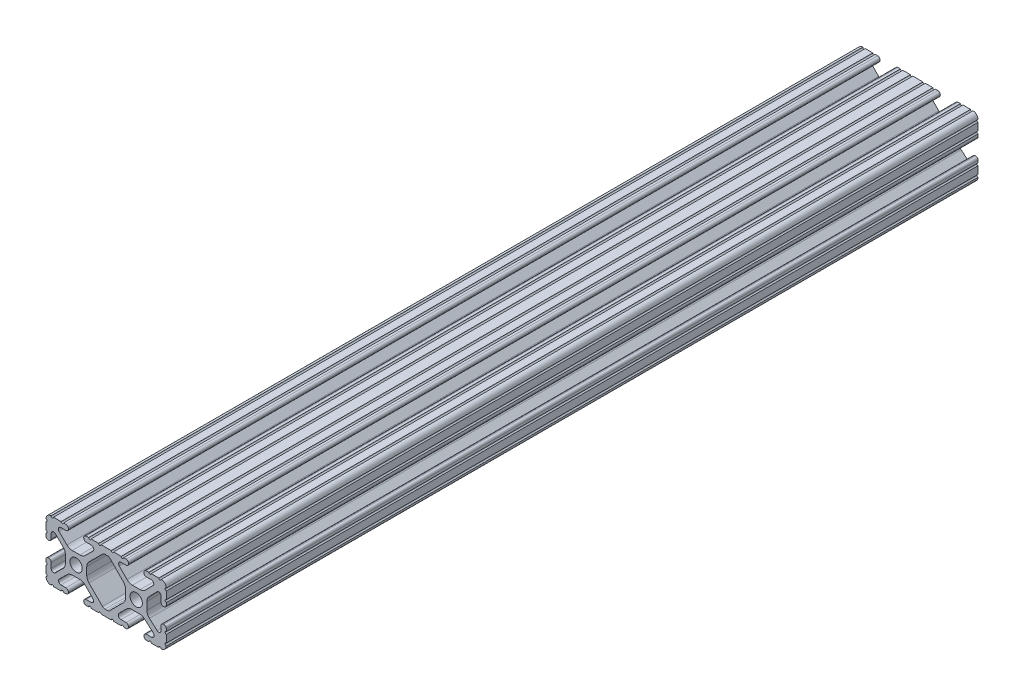
from build123d import *

# Parameters (mm, degrees)
SKETCH1_R           = 2.6035
BOSS_EXTRUDE1_DEPTH = 171.45


with BuildPart() as part:
    # Sketch1 → Boss-Extrude1 (new, symmetric)
    with BuildSketch(Plane.XY):
        with BuildLine():
            Line((18.01710265, 12.7), (16.98745015, 12.7))
            ThreePointArc((16.98745015, 12.7), (16.245730386, 12.392769614), (15.9385, 11.65104985))
            Line((15.9385, 11.65104985), (15.9385, 11.53922))
            ThreePointArc((15.9385, 11.53922), (16.245750844, 10.797450844), (16.98752, 10.4902))
            Line((16.98752, 10.4902), (19.116384363, 10.4902))
            ThreePointArc((19.116384363, 10.4902), (20.052502933, 9.869096983), (19.844087081, 8.765172272))
            Line((19.844087081, 8.765172272), (16.618993479, 5.455112286))
            ThreePointArc((16.618993479, 5.455112286), (15.578994274, 4.745442459), (14.344932584, 4.4958))
            Line((14.344932584, 4.4958), (11.083317835, 4.4958))
            ThreePointArc((11.083317835, 4.4958), (9.854330953, 4.743306833), (8.816955189, 5.447238587))
            Line((8.816955189, 5.447238587), (5.564154119, 8.762652677))
            ThreePointArc((5.564154119, 8.762652677), (5.352591412, 9.867473037), (6.289393385, 10.4902))
            Line((6.289393385, 10.4902), (8.41248, 10.4902))
            ThreePointArc((8.41248, 10.4902), (9.154249156, 10.797450844), (9.4615, 11.53922))
            Line((9.4615, 11.53922), (9.4615, 11.65104985))
            ThreePointArc((9.4615, 11.65104985), (9.154269614, 12.392769614), (8.41254985, 12.7))
            Line((8.41254985, 12.7), (7.38288465, 12.7))
            ThreePointArc((7.38288465, 12.7), (6.87488465, 12.192), (6.36688465, 12.7))
            Line((6.36688465, 12.7), (3.14958095, 12.7))
            ThreePointArc((3.14958095, 12.7), (2.64158095, 12.192), (2.13358095, 12.7))
            Line((2.13358095, 12.7), (-2.13358095, 12.7))
            ThreePointArc((-2.13358095, 12.7), (-2.64158095, 12.192), (-3.14958095, 12.7))
            Line((-3.14958095, 12.7), (-6.36689735, 12.7))
            ThreePointArc((-6.36689735, 12.7), (-6.87489735, 12.192), (-7.38289735, 12.7))
            Line((-7.38289735, 12.7), (-8.41254985, 12.7))
            ThreePointArc((-8.41254985, 12.7), (-9.154269614, 12.392769614), (-9.4615, 11.65104985))
            Line((-9.4615, 11.65104985), (-9.4615, 11.53922))
            ThreePointArc((-9.4615, 11.53922), (-9.154249156, 10.797450844), (-8.41248, 10.4902))
            Line((-8.41248, 10.4902), (-6.283641037, 10.4902))
            ThreePointArc((-6.283641037, 10.4902), (-5.297291557, 9.829633109), (-5.532576693, 8.666071843))
            Line((-5.532576693, 8.666071843), (-8.809985098, 5.416263103))
            ThreePointArc((-8.809985098, 5.416263103), (-9.836720513, 4.734920264), (-11.045536121, 4.4958))
            Line((-11.045536121, 4.4958), (-14.354463879, 4.4958))
            ThreePointArc((-14.354463879, 4.4958), (-15.563279487, 4.734920264), (-16.590014902, 5.416263103))
            Line((-16.590014902, 5.416263103), (-19.867423307, 8.666071843))
            ThreePointArc((-19.867423307, 8.666071843), (-20.102708443, 9.829633109), (-19.116358963, 10.4902))
            Line((-19.116358963, 10.4902), (-16.98752, 10.4902))
            ThreePointArc((-16.98752, 10.4902), (-16.245750844, 10.797450844), (-15.9385, 11.53922))
            Line((-15.9385, 11.53922), (-15.9385, 11.65104985))
            ThreePointArc((-15.9385, 11.65104985), (-16.245730386, 12.392769614), (-16.98745015, 12.7))
            Line((-16.98745015, 12.7), (-18.01711535, 12.7))
            ThreePointArc((-18.01711535, 12.7), (-18.52511535, 12.192), (-19.03311535, 12.7))
            Line((-19.03311535, 12.7), (-22.2504, 12.7))
            ThreePointArc((-22.2504, 12.7), (-22.758323491, 12.192000006), (-23.266399977, 12.699846982))
            ThreePointArc((-23.266399977, 12.699846982), (-24.782522516, 12.082522516), (-25.399846982, 10.566399977))
            ThreePointArc((-25.399846982, 10.566399977), (-24.892000006, 10.058323491), (-25.4, 9.5504))
            Line((-25.4, 9.5504), (-25.4, 6.3330836))
            ThreePointArc((-25.4, 6.3330836), (-24.892, 5.8250836), (-25.4, 5.3170836))
            Line((-25.4, 5.3170836), (-25.4, 4.237520184))
            ThreePointArc((-25.4, 4.237520184), (-25.107393763, 3.531106237), (-24.400979816, 3.2385))
            Line((-24.400979816, 3.2385), (-24.23922, 3.2385))
            ThreePointArc((-24.23922, 3.2385), (-23.497450844, 3.545750844), (-23.1902, 4.28752))
            Line((-23.1902, 4.28752), (-23.1902, 6.334741132))
            ThreePointArc((-23.1902, 6.334741132), (-22.556026952, 7.286023527), (-21.434002553, 7.066535717))
            Line((-21.434002553, 7.066535717), (-18.147950853, 3.808156468))
            ThreePointArc((-18.147950853, 3.808156468), (-17.452759693, 2.774838327), (-17.208501877, 1.553619571))
            Line((-17.208501877, 1.553619571), (-17.208501877, -1.695179196))
            ThreePointArc((-17.208501877, -1.695179196), (-17.450738657, -2.911536421), (-18.140486065, -3.942289578))
            Line((-18.140486065, -3.942289578), (-21.431579576, -7.227386226))
            ThreePointArc((-21.431579576, -7.227386226), (-22.55444896, -7.449940594), (-23.1902, -6.498002195))
            Line((-23.1902, -6.498002195), (-23.1902, -4.28752))
            ThreePointArc((-23.1902, -4.28752), (-23.497450844, -3.545750844), (-24.23922, -3.2385))
            Line((-24.23922, -3.2385), (-24.35098, -3.2385))
            ThreePointArc((-24.35098, -3.2385), (-25.092749156, -3.545750844), (-25.4, -4.28752))
            Line((-25.4, -4.28752), (-25.4, -5.3171344))
            ThreePointArc((-25.4, -5.3171344), (-24.892, -5.8251344), (-25.4, -6.3331344))
            Line((-25.4, -6.3331344), (-25.4, -9.5504))
            ThreePointArc((-25.4, -9.5504), (-24.892000006, -10.058323491), (-25.399846982, -10.566399977))
            ThreePointArc((-25.399846982, -10.566399977), (-24.782522516, -12.082522516), (-23.266399977, -12.699846982))
            ThreePointArc((-23.266399977, -12.699846982), (-22.758323491, -12.192000006), (-22.2504, -12.7))
            Line((-22.2504, -12.7), (-19.03308995, -12.7))
            ThreePointArc((-19.03308995, -12.7), (-18.52508995, -12.192), (-18.01708995, -12.7))
            Line((-18.01708995, -12.7), (-16.9874692, -12.7))
            ThreePointArc((-16.9874692, -12.7), (-16.245700044, -12.392749156), (-15.9384492, -11.65098))
            Line((-15.9384492, -11.65098), (-15.9384492, -11.53922))
            ThreePointArc((-15.9384492, -11.53922), (-16.245700044, -10.797450844), (-16.9874692, -10.4902))
            Line((-16.9874692, -10.4902), (-19.116358963, -10.4902))
            ThreePointArc((-19.116358963, -10.4902), (-20.055197748, -9.862578342), (-19.834124023, -8.755124678))
            Line((-19.834124023, -8.755124678), (-16.49660751, -5.423689618))
            ThreePointArc((-16.49660751, -5.423689618), (-15.467274017, -4.736928798), (-14.253591699, -4.4958))
            Line((-14.253591699, -4.4958), (-11.146408301, -4.4958))
            ThreePointArc((-11.146408301, -4.4958), (-9.932725983, -4.736928798), (-8.90339249, -5.423689618))
            Line((-8.90339249, -5.423689618), (-5.565875977, -8.755124678))
            ThreePointArc((-5.565875977, -8.755124678), (-5.344802252, -9.862578342), (-6.283641037, -10.4902))
            Line((-6.283641037, -10.4902), (-8.4125308, -10.4902))
            ThreePointArc((-8.4125308, -10.4902), (-9.154299956, -10.797450844), (-9.4615508, -11.53922))
            Line((-9.4615508, -11.53922), (-9.4615508, -11.65098))
            ThreePointArc((-9.4615508, -11.65098), (-9.154299956, -12.392749156), (-8.4125308, -12.7))
            Line((-8.4125308, -12.7), (-7.38287195, -12.7))
            ThreePointArc((-7.38287195, -12.7), (-6.87487195, -12.192), (-6.36687195, -12.7))
            Line((-6.36687195, -12.7), (-3.14960635, -12.7))
            ThreePointArc((-3.14960635, -12.7), (-2.64160635, -12.192), (-2.13360635, -12.7))
            Line((-2.13360635, -12.7), (2.13360635, -12.7))
            ThreePointArc((2.13360635, -12.7), (2.64159365, -12.1920127), (3.14958095, -12.7))
            Line((3.14958095, -12.7), (6.36691005, -12.7))
            ThreePointArc((6.36691005, -12.7), (6.87491005, -12.192), (7.38291005, -12.7))
            Line((7.38291005, -12.7), (8.4125308, -12.7))
            ThreePointArc((8.4125308, -12.7), (9.154299956, -12.392749156), (9.4615508, -11.65098))
            Line((9.4615508, -11.65098), (9.4615508, -11.53922))
            ThreePointArc((9.4615508, -11.53922), (9.154299956, -10.797450844), (8.4125308, -10.4902))
            Line((8.4125308, -10.4902), (6.289393385, -10.4902))
            ThreePointArc((6.289393385, -10.4902), (5.231590322, -9.783049717), (5.480677245, -8.535265862))
            Line((5.480677245, -8.535265862), (8.597933595, -5.423689618))
            ThreePointArc((8.597933595, -5.423689618), (9.627267088, -4.736928798), (10.840949406, -4.4958))
            Line((10.840949406, -4.4958), (14.102564155, -4.4958))
            ThreePointArc((14.102564155, -4.4958), (15.215927525, -4.697410182), (16.187895372, -5.276636531))
            Line((16.187895372, -5.276636531), (19.868247549, -8.482246082))
            ThreePointArc((19.868247549, -8.482246082), (20.188435806, -9.746879864), (19.116384363, -10.4902))
            Line((19.116384363, -10.4902), (16.9874692, -10.4902))
            ThreePointArc((16.9874692, -10.4902), (16.245700044, -10.797450844), (15.9384492, -11.53922))
            Line((15.9384492, -11.53922), (15.9384492, -11.65098))
            ThreePointArc((15.9384492, -11.65098), (16.245700044, -12.392749156), (16.9874692, -12.7))
            Line((16.9874692, -12.7), (18.01710265, -12.7))
            ThreePointArc((18.01710265, -12.7), (18.52510265, -12.192), (19.03310265, -12.7))
            Line((19.03310265, -12.7), (22.2504, -12.7))
            ThreePointArc((22.2504, -12.7), (22.758323491, -12.192000006), (23.266399977, -12.699846982))
            ThreePointArc((23.266399977, -12.699846982), (24.782522516, -12.082522516), (25.399846982, -10.566399977))
            ThreePointArc((25.399846982, -10.566399977), (24.892000006, -10.058323492), (25.4, -9.550400001))
            Line((25.4, -9.550400001), (25.4, -6.333083592))
            ThreePointArc((25.4, -6.333083592), (24.892000001, -5.825083593), (25.4, -5.317083593))
            Line((25.4, -5.317083593), (25.4, -4.237520184))
            ThreePointArc((25.4, -4.237520184), (25.107393763, -3.531106237), (24.400979816, -3.2385))
            Line((24.400979816, -3.2385), (24.189220184, -3.2385))
            ThreePointArc((24.189220184, -3.2385), (23.482806237, -3.531106237), (23.1902, -4.237520184))
            Line((23.1902, -4.237520184), (23.1902, -6.155876159))
            ThreePointArc((23.1902, -6.155876159), (22.62232736, -7.038258539), (21.583974541, -6.886926384))
            Line((21.583974541, -6.886926384), (18.29817066, -4.024970844))
            ThreePointArc((18.29817066, -4.024970844), (17.493730985, -2.946044689), (17.208501877, -1.630807374))
            Line((17.208501877, -1.630807374), (17.208501877, 1.630807374))
            ThreePointArc((17.208501877, 1.630807374), (17.442348332, 2.82673414), (18.109440981, 3.846495088))
            Line((18.109440981, 3.846495088), (21.526346532, 7.353420386))
            ThreePointArc((21.526346532, 7.353420386), (22.585896263, 7.574939077), (23.1902, 6.676867167))
            Line((23.1902, 6.676867167), (23.1902, 4.237520184))
            ThreePointArc((23.1902, 4.237520184), (23.482806237, 3.531106237), (24.189220184, 3.2385))
            Line((24.189220184, 3.2385), (24.400979816, 3.2385))
            ThreePointArc((24.400979816, 3.2385), (25.107393763, 3.531106237), (25.4, 4.237520184))
            Line((25.4, 4.237520184), (25.4, 5.3170836))
            ThreePointArc((25.4, 5.3170836), (24.891949193, 5.825134407), (25.4, 6.333185215))
            Line((25.4, 6.333185215), (25.4, 9.550400015))
            ThreePointArc((25.4, 9.550400015), (24.892000013, 10.058323498), (25.399846982, 10.566399977))
            ThreePointArc((25.399846982, 10.566399977), (24.782522516, 12.082522516), (23.266399977, 12.699846982))
            ThreePointArc((23.266399977, 12.699846982), (22.758323491, 12.192000006), (22.2504, 12.7))
            Line((22.2504, 12.7), (19.03310265, 12.7))
            ThreePointArc((19.03310265, 12.7), (18.52510265, 12.192), (18.01710265, 12.7))
        make_face()
        with Locations((-12.7, 0)):
            Circle(SKETCH1_R, mode=Mode.SUBTRACT)
        with Locations((12.7, 0)):
            Circle(SKETCH1_R, mode=Mode.SUBTRACT)
        with BuildLine():
            Line((-7.259513935, -3.869413038), (-1.545748891, -9.572766749))
            ThreePointArc((-1.545748891, -9.572766749), (-1.035199478, -9.913400116), (-0.433213048, -10.033))
            Line((-0.433213048, -10.033), (0.433213048, -10.033))
            ThreePointArc((0.433213048, -10.033), (1.035199478, -9.913400116), (1.545748891, -9.572766749))
            Line((1.545748891, -9.572766749), (7.259513935, -3.869413038))
            ThreePointArc((7.259513935, -3.869413038), (7.949261343, -2.838659881), (8.191498123, -1.622302656))
            Line((8.191498123, -1.622302656), (8.191498123, 1.622302656))
            ThreePointArc((8.191498123, 1.622302656), (7.955573352, 2.823327967), (7.282860769, 3.845864069))
            Line((7.282860769, 3.845864069), (1.675572808, 9.561086461))
            ThreePointArc((1.675572808, 9.561086461), (1.161034429, 9.910236611), (0.551456936, 10.033))
            Line((0.551456936, 10.033), (-0.395199982, 10.033))
            ThreePointArc((-0.395199982, 10.033), (-0.994772524, 9.914396349), (-1.50403329, 9.576450301))
            Line((-1.50403329, 9.576450301), (-7.252049147, 3.876839553))
            ThreePointArc((-7.252049147, 3.876839553), (-7.947240307, 2.843521412), (-8.191498123, 1.622302656))
            Line((-8.191498123, 1.622302656), (-8.191498123, -1.622302656))
            ThreePointArc((-8.191498123, -1.622302656), (-7.949261343, -2.838659881), (-7.259513935, -3.869413038))
        make_face(mode=Mode.SUBTRACT)
    extrude(amount=BOSS_EXTRUDE1_DEPTH, both=True)


solid = part.part
